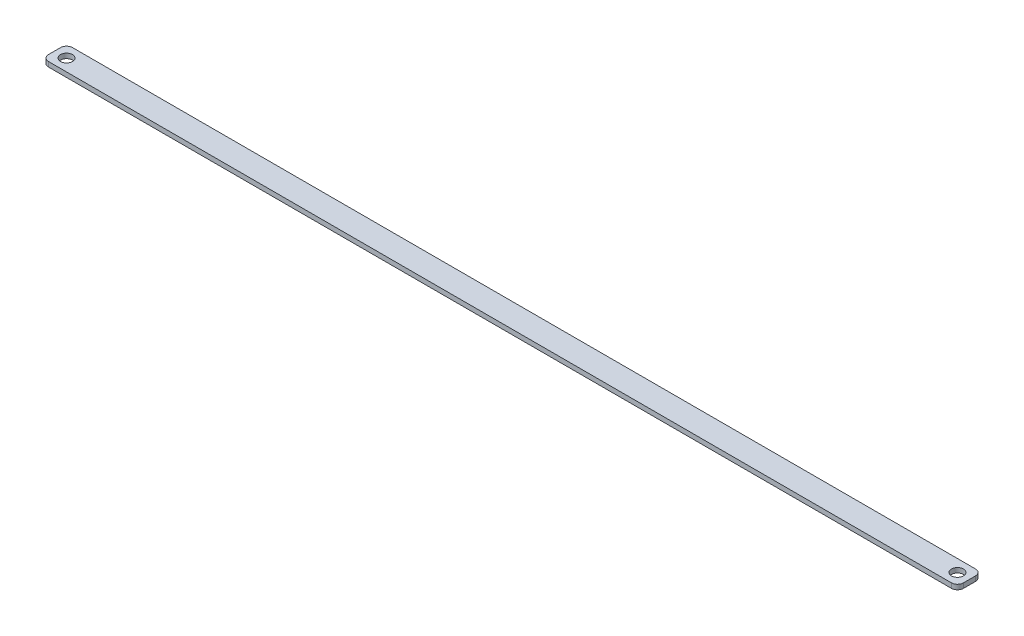
from build123d import *

# Parameters (mm, degrees)
SKETCH1_R           = 2.5
BOSS_EXTRUDE2_DEPTH = 2
FLEX1_OUTLINE_R     = 2.5
FLEX1_DEPTH         = 2


# Read off the part's stored shape, not the designer's step: Flex1
with BuildPart() as part:
    # Sketch1 → Boss-Extrude2 (new body)
    with BuildSketch(Plane(origin=(0, 0, 0), x_dir=(1, 0, 0), z_dir=(0, 1, 0))):
        with BuildLine():
            Line((2.5, 0), (47.5, 0))
            ThreePointArc((47.5, 0), (49.267766953, 0.732233047), (50, 2.5))
            Line((50, 2.5), (50, 7.5))
            ThreePointArc((50, 7.5), (49.267766953, 9.267766953), (47.5, 10))
            Line((47.5, 10), (2.5, 10))
            ThreePointArc((2.5, 10), (0.732233047, 9.267766953), (0, 7.5))
            Line((0, 7.5), (0, 2.5))
            ThreePointArc((0, 2.5), (0.732233047, 0.732233047), (2.5, 0))
        make_face()
        with Locations(Location((5, 5, 0), (0, 0, 270))):
            Circle(SKETCH1_R, mode=Mode.SUBTRACT)
        with Locations(Location((45, 5, 0), (0, 0, 270))):
            Circle(SKETCH1_R, mode=Mode.SUBTRACT)
    extrude(amount=BOSS_EXTRUDE2_DEPTH)

    # Flex1 outline → Flex1 (add)
    # profile 1 of 4: a face of its own
    with BuildSketch(Plane(origin=(0, 0, 0), x_dir=(1, 0, 0), z_dir=(0, 1, 0))):
        with BuildLine():
            Line((2.5, 10), (-158.5152852, 10))
            ThreePointArc((-158.5152852, 10), (-160.283052153, 9.267766953), (-161.0152852, 7.5))
            Line((-161.0152852, 7.5), (-161.0152852, 2.5))
            ThreePointArc((-161.0152852, 2.5), (-160.283052153, 0.732233047), (-158.5152852, 0))
            Line((-158.5152852, 0), (2.5, 0))
            ThreePointArc((2.5, 0), (0.732233047, 0.732233047), (0, 2.5))
            Line((0, 2.5), (0, 7.5))
            ThreePointArc((0, 7.5), (0.732233047, 9.267766953), (2.5, 10))
        make_face()
        with Locations((-156.0152852, 5)):
            Circle(FLEX1_OUTLINE_R, mode=Mode.SUBTRACT)
    # profile 2 of 4: a face of its own
    with BuildSketch(Plane(origin=(0, 0, 0), x_dir=(1, 0, 0), z_dir=(0, 1, 0))):
        with BuildLine():
            Line((216.4847148, 10), (47.5, 10))
            ThreePointArc((47.5, 10), (49.267766953, 9.267766953), (50, 7.5))
            Line((50, 7.5), (50, 2.5))
            ThreePointArc((50, 2.5), (49.267766953, 0.732233047), (47.5, 0))
            Line((47.5, 0), (216.4847148, 0))
            ThreePointArc((216.4847148, 0), (218.252481753, 0.732233047), (218.9847148, 2.5))
            Line((218.9847148, 2.5), (218.9847148, 7.5))
            ThreePointArc((218.9847148, 7.5), (218.252481753, 9.267766953), (216.4847148, 10))
        make_face()
        with Locations((213.9847148, 5)):
            Circle(FLEX1_OUTLINE_R, mode=Mode.SUBTRACT)
    # profile 3 of 4: a face of its own
    with BuildSketch(Plane(origin=(0, 0, 0), x_dir=(1, 0, 0), z_dir=(0, 1, 0))):
        with Locations((5, 5)):
            Circle(FLEX1_OUTLINE_R)
    # profile 4 of 4: a face of its own
    with BuildSketch(Plane(origin=(0, 0, 0), x_dir=(1, 0, 0), z_dir=(0, 1, 0))):
        with Locations((45, 5)):
            Circle(FLEX1_OUTLINE_R)
    extrude(amount=FLEX1_DEPTH)


solid = part.part
